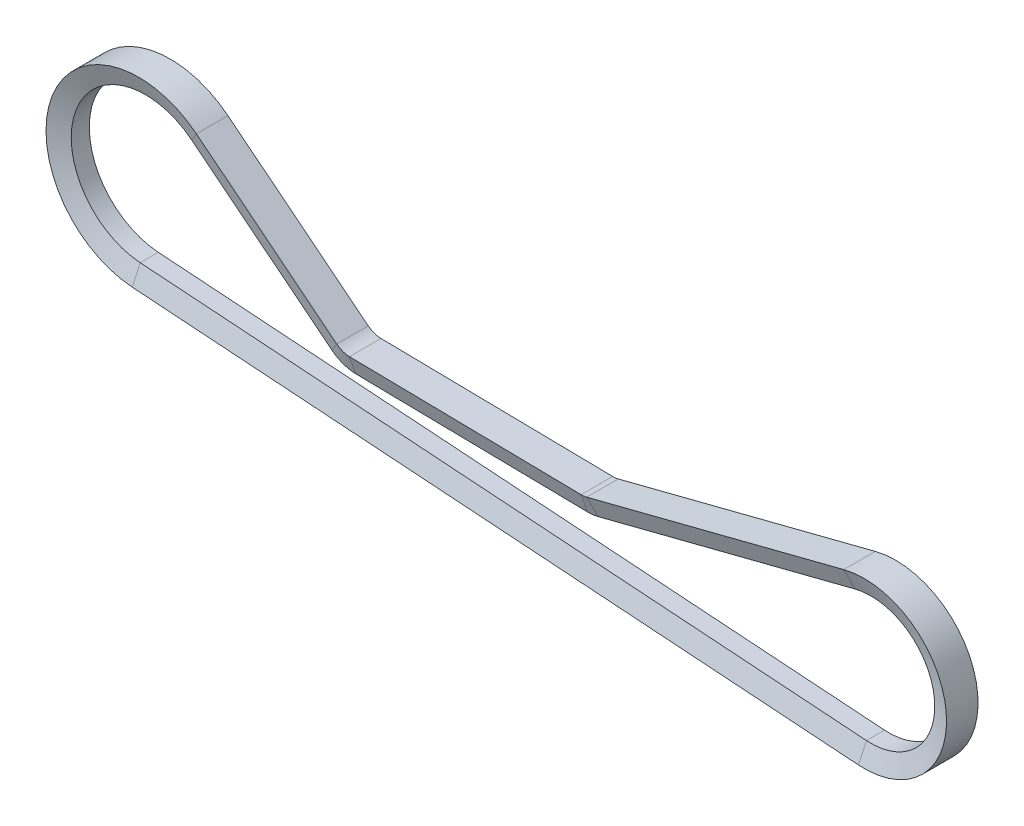
from build123d import *


with BuildPart() as part:
    # Sweep1: sweep along a path in Sketch2
    with BuildLine(Plane.XY) as sweep1_path:
        Line((-1.732144364, -24.814618728), (-221.175976896, -9.496696583))
        ThreePointArc((-221.175976896, -9.496696583), (-245.317195851, 28.597094054), (-201.770475212, 40.328183489))
        Line((-201.770475212, 40.328183489), (-159.381113511, 6.530013958))
        ThreePointArc((-159.381113511, 6.530013958), (-157.567416257, 5.518260754), (-155.524274728, 5.145816174))
        Line((-155.524274728, 5.145816174), (-85.533284096, 4.022771093))
        ThreePointArc((-85.533284096, 4.022771093), (-84.688741363, 4.065532764), (-83.857369112, 4.220132783))
        Line((-83.857369112, 4.220132783), (-6.166017953, 24.098669036))
        ThreePointArc((-6.166017953, 24.098669036), (24.77342673, 2.245652409), (-1.732144364, -24.814618728))
    # Sketch3 → Sweep1 (sweep)
    with BuildSketch(Plane(origin=(-6.166017953, 24.098669036, 0), x_dir=(0.247880118390004, -0.9687907136770861, 0), z_dir=(0.9687907136770861, 0.247880118390004, 0))):
        Polygon((0, -4.7625), (0, 4.7625), (5.588, 2.728634331), (5.588, -2.728634331), align=None)
    sweep(path=sweep1_path.line)


solid = part.part
